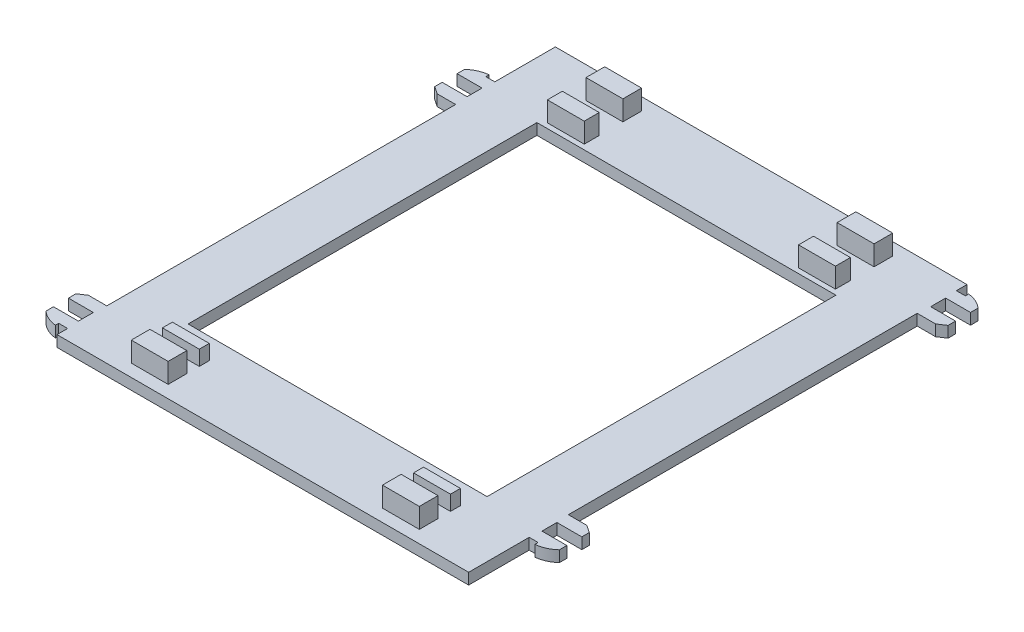
from build123d import *

# Parameters (mm, degrees)
BOSS_EXTRUDE1_DEPTH = 2.23
SKETCH2_W           = 7.4
SKETCH2_H           = 3.75
SKETCH2_H_2         = 3
BOSS_EXTRUDE2_DEPTH = 4
SKETCH3_W           = 60
SKETCH3_H           = 70
CUT_EXTRUDE1_DEPTH  = 10
CUT_EXTRUDE2_DEPTH  = 0.5
SKETCH5_W           = 7.4
SKETCH5_H           = 2
BOSS_EXTRUDE3_DEPTH = 3


with BuildPart() as part:
    # Sketch1 → Boss-Extrude1 (new body)
    with BuildSketch(Plane(origin=(0, 0, 0), x_dir=(1, 0, 0), z_dir=(0, 1, 0))):
        with BuildLine():
            Line((43.1, 48.52), (43.1, 47.87))
            Line((43.1, 47.87), (41.3, 47.87))
            Line((41.3, 47.87), (41.3, 50))
            Line((41.3, 50), (-41.3, 50))
            Line((-41.3, 50), (-41.3, 37.85))
            Line((-41.3, 37.85), (-43.1, 37.85))
            Line((-43.1, 37.85), (-43.1, 38.5))
            ThreePointArc((-43.1, 38.5), (-44.922195524, 38.020142239), (-46.5, 36.99))
            Line((-46.5, 36.99), (-46.5, 35.49))
            Line((-46.5, 35.49), (-41.5, 35.49))
            Line((-41.5, 35.49), (-41.5, 32.49))
            Line((-41.5, 32.49), (-46.5, 32.49))
            Line((-46.5, 32.49), (-46.5, 30.99))
            Line((-46.5, 30.99), (-45, 29.99))
            Line((-45, 29.99), (-41.3, 29.99))
            Line((-41.3, 29.99), (-41.3, -40.01))
            Line((-41.3, -40.01), (-45, -40.01))
            Line((-45, -40.01), (-46.5, -41.01))
            Line((-46.5, -41.01), (-46.5, -42.51))
            Line((-46.5, -42.51), (-41.5, -42.51))
            Line((-41.5, -42.51), (-41.5, -45.51))
            Line((-41.5, -45.51), (-46.5, -45.51))
            Line((-46.5, -45.51), (-46.5, -47.01))
            ThreePointArc((-46.5, -47.01), (-44.922195524, -48.040142239), (-43.1, -48.52))
            Line((-43.1, -48.52), (-43.1, -47.87))
            Line((-43.1, -47.87), (-41.3, -47.87))
            Line((-41.3, -47.87), (-41.3, -50))
            Line((-41.3, -50), (41.3, -50))
            Line((41.3, -50), (41.3, -37.85))
            Line((41.3, -37.85), (43.1, -37.85))
            Line((43.1, -37.85), (43.1, -38.5))
            ThreePointArc((43.1, -38.5), (44.922195524, -38.020142239), (46.5, -36.99))
            Line((46.5, -36.99), (46.5, -35.49))
            Line((46.5, -35.49), (41.5, -35.49))
            Line((41.5, -35.49), (41.5, -32.49))
            Line((41.5, -32.49), (46.5, -32.49))
            Line((46.5, -32.49), (46.5, -30.99))
            Line((46.5, -30.99), (45, -29.99))
            Line((45, -29.99), (41.3, -29.99))
            Line((41.3, -29.99), (41.3, 40.01))
            Line((41.3, 40.01), (45, 40.01))
            Line((45, 40.01), (46.5, 41.01))
            Line((46.5, 41.01), (46.5, 42.51))
            Line((46.5, 42.51), (41.5, 42.51))
            Line((41.5, 42.51), (41.5, 45.51))
            Line((41.5, 45.51), (46.5, 45.51))
            Line((46.5, 45.51), (46.5, 47.01))
            ThreePointArc((46.5, 47.01), (44.922195524, 48.040142239), (43.1, 48.52))
        make_face()
    extrude(amount=BOSS_EXTRUDE1_DEPTH)

    # Sketch2 → Boss-Extrude2 (add)
    with BuildSketch(Plane(origin=(0, 2.23, 0), x_dir=(1, 0, 0), z_dir=(0, 1, 0))):
        with Locations((-25.2, -45.625)):
            Rectangle(SKETCH2_W, SKETCH2_H)
        with Locations((25.2, -45.625)):
            Rectangle(SKETCH2_W, SKETCH2_H)
        with Locations((25.2, 45.625)):
            Rectangle(SKETCH2_W, SKETCH2_H)
        with Locations((-25.2, 45.625)):
            Rectangle(SKETCH2_W, SKETCH2_H)
        with Locations((-25.2, 37.5)):
            Rectangle(SKETCH2_W, SKETCH2_H_2)
        with Locations((25.2, 37.5)):
            Rectangle(SKETCH2_W, SKETCH2_H_2)
    extrude(amount=BOSS_EXTRUDE2_DEPTH)

    # Sketch3 → Cut-Extrude1 (cut)
    with BuildSketch(Plane(origin=(0, 2.23, 0), x_dir=(1, 0, 0), z_dir=(0, 1, 0))):
        Rectangle(SKETCH3_W, SKETCH3_H)
    extrude(amount=-CUT_EXTRUDE1_DEPTH, mode=Mode.SUBTRACT)

    # Sketch4 → Cut-Extrude2 (cut)
    with BuildSketch(Plane.XZ):
        Polygon((4.640384615, -43.419230769), (4.640384615, -45.291666667), (4.070512821, -45.291666667), (4.070512821, -43.419230769), (2.198076923, -43.419230769), (2.198076923, -42.849358974), (4.070512821, -42.849358974), (4.070512821, -40.976923077), (4.640384615, -40.976923077), (4.640384615, -42.849358974), (6.512820513, -42.849358974), (6.512820513, -43.419230769), align=None)
        Polygon((1.221153846, -45.698717949), (1.221153846, -46.35), (-2.116666667, -46.35), (0.54697516, -40.651282051), (-2.03525641, -40.651282051), (-2.03525641, -40), (1.465384615, -40), (-1.198257212, -45.698717949), align=None)
        with BuildLine():
            add(Edge.make_bspline(
                [(-3.175, -44.482652244), (-3.262918211, -44.565594294), (-3.433284709, -44.726318068), (-3.671176807, -44.969181062), (-3.884395029, -45.204215059), (-4.071386431, -45.432230465), (-4.235563138, -45.650653984), (-4.373446797, -45.862117777), (-4.487450991, -46.065713922), (-4.546079998, -46.202765549), (-4.574238782, -46.268589744)],
                knots=[0, 0, 0, 0, 1.268948445, 2.458947928, 3.568481392, 4.599651985, 5.554146552, 6.435803127, 7.248735662, 8, 8, 8, 8], degree=3))
            Line((-4.574238782, -46.268589744), (-4.759955929, -46.268589744))
            add(Edge.make_bspline(
                [(-4.759955929, -46.268589744), (-4.792788221, -46.198486652), (-4.860615985, -46.053661673), (-4.986779978, -45.841364869), (-5.132525091, -45.623706079), (-5.300867212, -45.402881295), (-5.491310702, -45.177687257), (-5.702118152, -44.94759275), (-5.93585869, -44.714525691), (-6.101847246, -44.561381426), (-6.187179487, -44.482652244)],
                knots=[0, 0, 0, 0, 0.806674609, 1.666497584, 2.571372681, 3.536893284, 4.559717442, 5.645448402, 6.789560146, 8, 8, 8, 8], degree=3))
            Line((-6.187179487, -44.482652244), (-6.187179487, -44.151923077))
            add(Edge.make_bspline(
                [(-6.187179487, -44.151923077), (-6.116537815, -44.184471117), (-5.978890638, -44.247891839), (-5.781903944, -44.34935602), (-5.597143614, -44.448436612), (-5.427913951, -44.551377879), (-5.270864773, -44.651733434), (-5.129759329, -44.755968393), (-5.000056754, -44.857829341), (-4.922299946, -44.930706152), (-4.884615385, -44.966025641)],
                knots=[0, 0, 0, 0, 1.209567812, 2.356875072, 3.445837619, 4.469393631, 5.437034397, 6.343238918, 7.197056603, 8, 8, 8, 8], degree=3))
            Line((-4.884615385, -44.966025641), (-4.884615385, -38.127564103))
            Line((-4.884615385, -38.127564103), (-4.477564103, -38.127564103))
            Line((-4.477564103, -38.127564103), (-4.477564103, -44.966025641))
            add(Edge.make_bspline(
                [(-4.477564103, -44.966025641), (-4.378031962, -44.888388472), (-4.177950241, -44.732320508), (-3.858882125, -44.521130617), (-3.525108924, -44.32477265), (-3.292360048, -44.209864), (-3.175, -44.151923077)],
                knots=[0, 0, 0, 0, 0.98362379, 1.977302407, 2.980085786, 4, 4, 4, 4], degree=3))
            Line((-3.175, -44.151923077), (-3.175, -44.482652244))
        make_face()
    extrude(amount=-CUT_EXTRUDE2_DEPTH, mode=Mode.SUBTRACT)

    # Sketch5 → Boss-Extrude3 (add)
    with BuildSketch(Plane(origin=(0, 2.23, 0), x_dir=(1, 0, 0), z_dir=(0, 1, 0))):
        with Locations((-25.2, -40.25)):
            Rectangle(SKETCH5_W, SKETCH5_H)
        with Locations((25.2, -40.25)):
            Rectangle(SKETCH5_W, SKETCH5_H)
    extrude(amount=BOSS_EXTRUDE3_DEPTH)


solid = part.part
